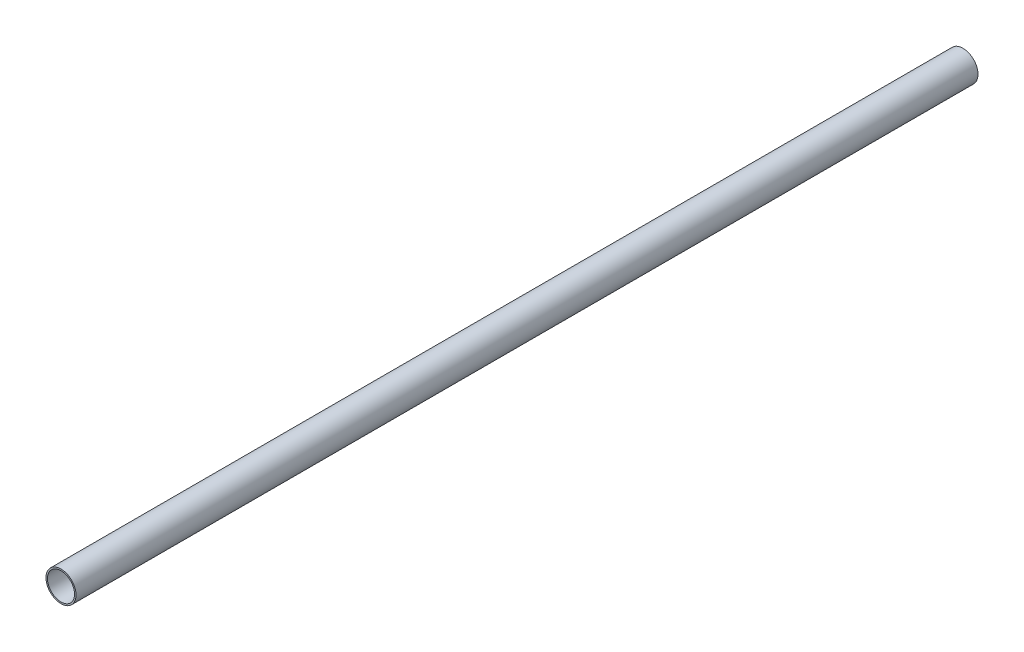
from build123d import *

# Parameters (mm, degrees)
SKETCH1_R           = 10
SKETCH1_R_2         = 9
BOSS_EXTRUDE1_DEPTH = 600


with BuildPart() as part:
    # Sketch1 → Boss-Extrude1 (new body)
    with BuildSketch(Plane.XY):
        Circle(SKETCH1_R)
        Circle(SKETCH1_R_2, mode=Mode.SUBTRACT)
    extrude(amount=BOSS_EXTRUDE1_DEPTH)


solid = part.part
